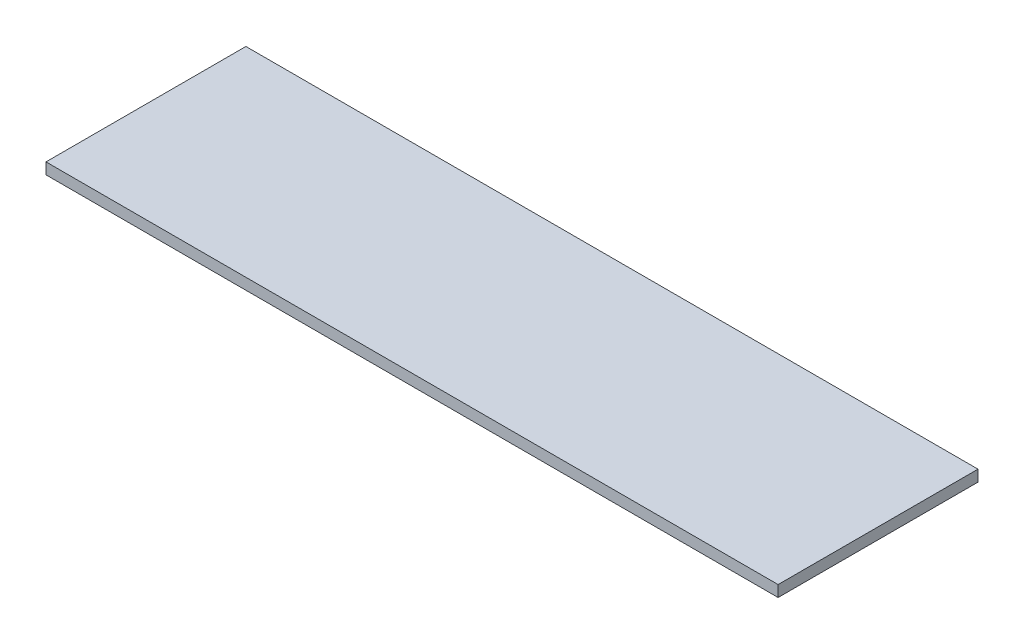
from build123d import *

# Parameters (mm, degrees)
SKETCH1_W           = 293
SKETCH1_H           = 80
BOSS_EXTRUDE1_DEPTH = 4.5


with BuildPart() as part:
    # Sketch1 → Boss-Extrude1 (new body)
    with BuildSketch(Plane(origin=(0, 0, 0), x_dir=(1, 0, 0), z_dir=(0, 1, 0))):
        Rectangle(SKETCH1_W, SKETCH1_H)
    extrude(amount=BOSS_EXTRUDE1_DEPTH)


solid = part.part
